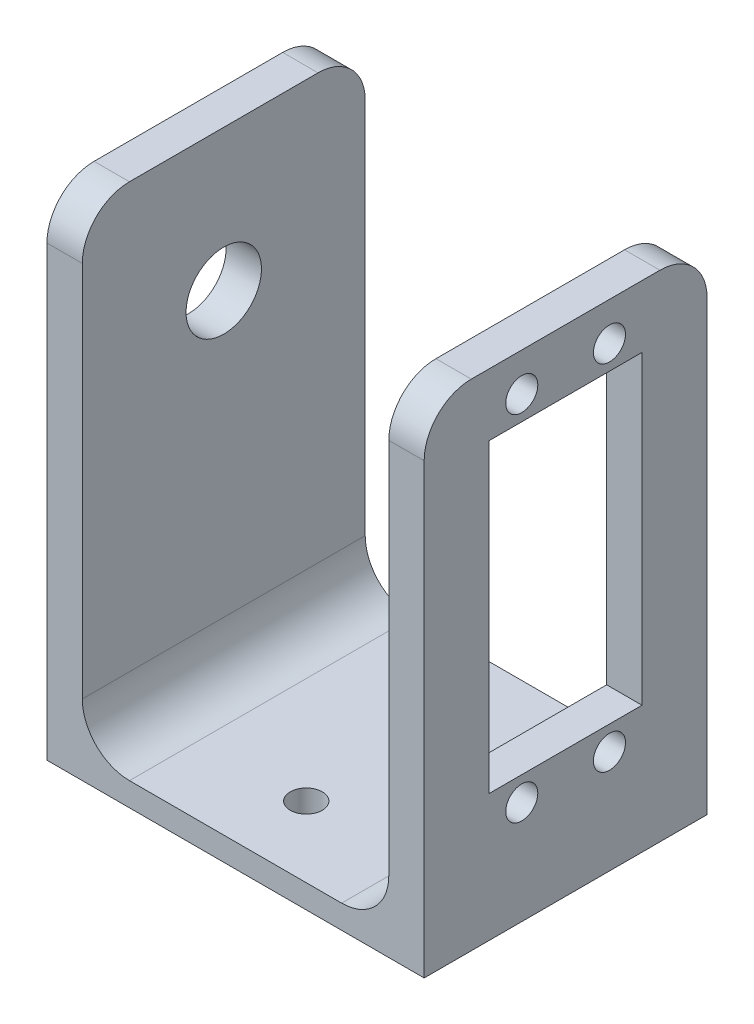
from build123d import *

# Parameters (mm, degrees)
SKETCH1_W           = 50.8
SKETCH1_H           = 38.1
BOSS_EXTRUDE1_DEPTH = 3.175
SKETCH2_W           = 4.7625
SKETCH2_H           = 38.1
BOSS_EXTRUDE2_DEPTH = 63.5
FILLET1_R           = 6.35
CUT_EXTRUDE1_REACH  = 94.075
SKETCH3_R           = 2.159
SKETCH3_W           = 20.574
SKETCH3_H           = 41.148
CUT_EXTRUDE2_REACH  = 91.803
SKETCH4_R           = 2.159
CUT_EXTRUDE3_REACH  = 94.075
SKETCH5_R           = 5.08


with BuildPart() as part:
    # Sketch1 → Boss-Extrude1 (new body)
    with BuildSketch(Plane(origin=(0, 0, 0), x_dir=(1, 0, 0), z_dir=(0, 1, 0))):
        with Locations((25.4, 19.05)):
            Rectangle(SKETCH1_W, SKETCH1_H)
    extrude(amount=BOSS_EXTRUDE1_DEPTH)

    # Sketch2 → Boss-Extrude2 (add)
    with BuildSketch(Plane(origin=(0, 3.175, 0), x_dir=(1, 0, 0), z_dir=(0, 1, 0))):
        with Locations((48.41875, 19.05)):
            Rectangle(SKETCH2_W, SKETCH2_H)
        with Locations((2.38125, 19.05)):
            Rectangle(SKETCH2_W, SKETCH2_H)
    extrude(amount=BOSS_EXTRUDE2_DEPTH)

    # Fillet1
    fillet1_edges = [part.edges().sort_by_distance(p)[0] for p in [
        (4.7625, 3.175, -19.05),
        (46.0375, 3.175, -19.05),
        (48.41875, 66.675, 0),
        (48.41875, 66.675, -38.1),
        (2.38125, 66.675, -38.1),
        (2.38125, 66.675, 0),
    ]]
    fillet(fillet1_edges, radius=FILLET1_R)

    # Sketch3 → Cut-Extrude1 (cut, up to next)
    with BuildSketch(Plane(origin=(50.8, 0, 0), x_dir=(0, 0, -1), z_dir=(1, 0, 0)), mode=Mode.PRIVATE) as cut_extrude1_sk1:
        with Locations((24.9555, 61.5315)):
            Circle(SKETCH3_R)
    cut_extrude1_tool1 = extrude(cut_extrude1_sk1.sketch, amount=-CUT_EXTRUDE1_REACH, mode=Mode.PRIVATE) & part.part
    # Sketch3 → Cut-Extrude1 (cut, up to next)
    with BuildSketch(Plane(origin=(50.8, 0, 0), x_dir=(0, 0, -1), z_dir=(1, 0, 0)), mode=Mode.PRIVATE) as cut_extrude1_sk2:
        with Locations((13.1445, 61.5315)):
            Circle(SKETCH3_R)
    cut_extrude1_tool2 = extrude(cut_extrude1_sk2.sketch, amount=-CUT_EXTRUDE1_REACH, mode=Mode.PRIVATE) & part.part
    # Sketch3 → Cut-Extrude1 (cut, up to next)
    with BuildSketch(Plane(origin=(50.8, 0, 0), x_dir=(0, 0, -1), z_dir=(1, 0, 0)), mode=Mode.PRIVATE) as cut_extrude1_sk3:
        with Locations((13.1445, 13.9065)):
            Circle(SKETCH3_R)
    cut_extrude1_tool3 = extrude(cut_extrude1_sk3.sketch, amount=-CUT_EXTRUDE1_REACH, mode=Mode.PRIVATE) & part.part
    # Sketch3 → Cut-Extrude1 (cut, up to next)
    with BuildSketch(Plane(origin=(50.8, 0, 0), x_dir=(0, 0, -1), z_dir=(1, 0, 0)), mode=Mode.PRIVATE) as cut_extrude1_sk4:
        with Locations((24.9555, 13.9065)):
            Circle(SKETCH3_R)
    cut_extrude1_tool4 = extrude(cut_extrude1_sk4.sketch, amount=-CUT_EXTRUDE1_REACH, mode=Mode.PRIVATE) & part.part
    # Sketch3 → Cut-Extrude1 (cut, up to next)
    with BuildSketch(Plane(origin=(50.8, 0, 0), x_dir=(0, 0, -1), z_dir=(1, 0, 0)), mode=Mode.PRIVATE) as cut_extrude1_sk5:
        with Locations((19.05, 37.719)):
            Rectangle(SKETCH3_W, SKETCH3_H)
    cut_extrude1_tool5 = extrude(cut_extrude1_sk5.sketch, amount=-CUT_EXTRUDE1_REACH, mode=Mode.PRIVATE) & part.part
    add(cut_extrude1_tool1.solids().sort_by_distance((50.8, 61.5315, -24.9555))[0], mode=Mode.SUBTRACT)
    add(cut_extrude1_tool2.solids().sort_by_distance((50.8, 61.5315, -13.1445))[0], mode=Mode.SUBTRACT)
    add(cut_extrude1_tool3.solids().sort_by_distance((50.8, 13.9065, -13.1445))[0], mode=Mode.SUBTRACT)
    add(cut_extrude1_tool4.solids().sort_by_distance((50.8, 13.9065, -24.9555))[0], mode=Mode.SUBTRACT)
    add(cut_extrude1_tool5.solids().sort_by_distance((50.8, 37.719, -19.05))[0], mode=Mode.SUBTRACT)

    # Sketch4 → Cut-Extrude2 (cut, up to next)
    with BuildSketch(Plane(origin=(0, 3.175, 0), x_dir=(1, 0, 0), z_dir=(0, 1, 0)), mode=Mode.PRIVATE) as cut_extrude2_sk1:
        with Locations((25.4, 28.575)):
            Circle(SKETCH4_R)
    cut_extrude2_tool1 = extrude(cut_extrude2_sk1.sketch, amount=-CUT_EXTRUDE2_REACH, mode=Mode.PRIVATE) & part.part
    # Sketch4 → Cut-Extrude2 (cut, up to next)
    with BuildSketch(Plane(origin=(0, 3.175, 0), x_dir=(1, 0, 0), z_dir=(0, 1, 0)), mode=Mode.PRIVATE) as cut_extrude2_sk2:
        with Locations((25.4, 9.525)):
            Circle(SKETCH4_R)
    cut_extrude2_tool2 = extrude(cut_extrude2_sk2.sketch, amount=-CUT_EXTRUDE2_REACH, mode=Mode.PRIVATE) & part.part
    add(cut_extrude2_tool1.solids().sort_by_distance((25.4, 3.175, -28.575))[0], mode=Mode.SUBTRACT)
    add(cut_extrude2_tool2.solids().sort_by_distance((25.4, 3.175, -9.525))[0], mode=Mode.SUBTRACT)

    # Sketch5 → Cut-Extrude3 (cut, up to next)
    with BuildSketch(Plane.ZY, mode=Mode.PRIVATE) as cut_extrude3_sk1:
        with Locations((-19.05, 47.625)):
            Circle(SKETCH5_R)
    cut_extrude3_tool1 = extrude(cut_extrude3_sk1.sketch, amount=-CUT_EXTRUDE3_REACH, mode=Mode.PRIVATE) & part.part
    add(cut_extrude3_tool1.solids().sort_by_distance((0, 47.625, -19.05))[0], mode=Mode.SUBTRACT)


solid = part.part
